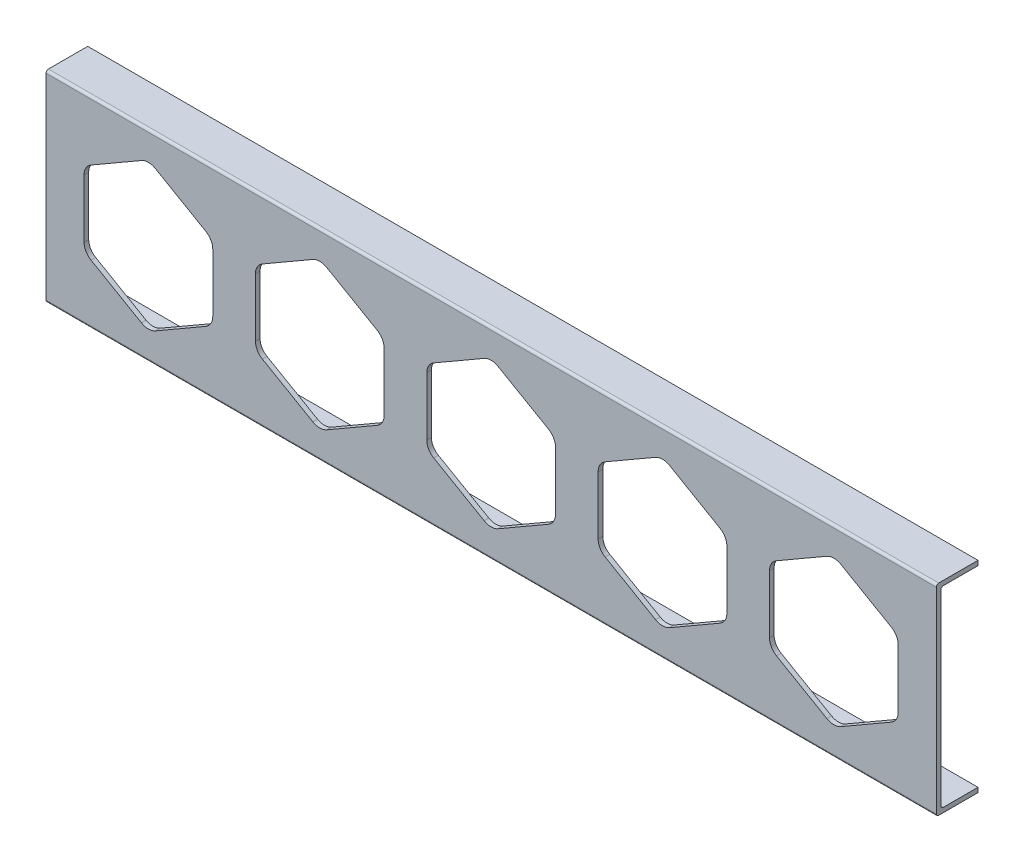
from build123d import *

# Parameters (mm, degrees)
BOSS_EXTRUDE1_DEPTH = 304.8
CUT_EXTRUDE1_REACH  = 314.468


with BuildPart() as part:
    # Sketch1 → Boss-Extrude1 (new body)
    with BuildSketch(Plane(origin=(0, 0, 0), x_dir=(0, 0, -1), z_dir=(1, 0, 0))):
        with BuildLine():
            Line((-0.762, 67.29984), (12.7, 67.29984))
            Line((12.7, 67.29984), (12.7, 65.71234))
            Line((12.7, 65.71234), (0.8255, 65.71234))
            ThreePointArc((0.8255, 65.71234), (0.241783352, 65.470556648), (0, 64.88684))
            Line((0, 64.88684), (0, 0.8255))
            ThreePointArc((0, 0.8255), (0.241783352, 0.241783352), (0.8255, 0))
            Line((0.8255, 0), (12.7, 0))
            Line((12.7, 0), (12.7, -1.5875))
            Line((12.7, -1.5875), (-0.762, -1.5875))
            ThreePointArc((-0.762, -1.5875), (-1.345716648, -1.345716648), (-1.5875, -0.762))
            Line((-1.5875, -0.762), (-1.5875, 66.47434))
            ThreePointArc((-1.5875, 66.47434), (-1.345716648, 67.058056648), (-0.762, 67.29984))
        make_face()
    extrude(amount=BOSS_EXTRUDE1_DEPTH)

    # Sketch2 → Cut-Extrude1 (cut, up to next)
    with BuildSketch(Plane.XY.offset(1.5875), mode=Mode.PRIVATE) as cut_extrude1_sk1:
        with BuildLine():
            Line((32.681340962, 56.921546337), (15.411988703, 46.951081161))
            ThreePointArc((15.411988703, 46.951081161), (13.668792717, 45.207885176), (13.030738703, 42.826635176))
            Line((13.030738703, 42.826635176), (13.030738703, 22.885704824))
            ThreePointArc((13.030738703, 22.885704824), (13.668792717, 20.504454824), (15.411988703, 18.761258839))
            Line((15.411988703, 18.761258839), (32.681340962, 8.790793663))
            ThreePointArc((32.681340962, 8.790793663), (35.062590962, 8.152739649), (37.443840962, 8.790793663))
            Line((37.443840962, 8.790793663), (54.713193222, 18.761258839))
            ThreePointArc((54.713193222, 18.761258839), (56.456389207, 20.504454824), (57.094443222, 22.885704824))
            Line((57.094443222, 22.885704824), (57.094443222, 42.826635176))
            ThreePointArc((57.094443222, 42.826635176), (56.456389207, 45.207885176), (54.713193222, 46.951081161))
            Line((54.713193222, 46.951081161), (37.443840962, 56.921546337))
            ThreePointArc((37.443840962, 56.921546337), (35.062590962, 57.559600351), (32.681340962, 56.921546337))
        make_face()
    cut_extrude1_tool1 = extrude(cut_extrude1_sk1.sketch, amount=-CUT_EXTRUDE1_REACH, mode=Mode.PRIVATE) & part.part
    # Sketch2 → Cut-Extrude1 (cut, up to next)
    with BuildSketch(Plane.XY.offset(1.5875), mode=Mode.PRIVATE) as cut_extrude1_sk2:
        with BuildLine():
            Line((91.350045481, 56.921546337), (74.080693222, 46.951081161))
            ThreePointArc((74.080693222, 46.951081161), (72.337497236, 45.207885176), (71.699443222, 42.826635176))
            Line((71.699443222, 42.826635176), (71.699443222, 22.885704824))
            ThreePointArc((71.699443222, 22.885704824), (72.337497236, 20.504454824), (74.080693222, 18.761258839))
            Line((74.080693222, 18.761258839), (91.350045481, 8.790793663))
            ThreePointArc((91.350045481, 8.790793663), (93.731295481, 8.152739649), (96.112545481, 8.790793663))
            Line((96.112545481, 8.790793663), (113.381897741, 18.761258839))
            ThreePointArc((113.381897741, 18.761258839), (115.125093726, 20.504454824), (115.763147741, 22.885704824))
            Line((115.763147741, 22.885704824), (115.763147741, 42.826635176))
            ThreePointArc((115.763147741, 42.826635176), (115.125093726, 45.207885176), (113.381897741, 46.951081161))
            Line((113.381897741, 46.951081161), (96.112545481, 56.921546337))
            ThreePointArc((96.112545481, 56.921546337), (93.731295481, 57.559600351), (91.350045481, 56.921546337))
        make_face()
    cut_extrude1_tool2 = extrude(cut_extrude1_sk2.sketch, amount=-CUT_EXTRUDE1_REACH, mode=Mode.PRIVATE) & part.part
    # Sketch2 → Cut-Extrude1 (cut, up to next)
    with BuildSketch(Plane.XY.offset(1.5875), mode=Mode.PRIVATE) as cut_extrude1_sk3:
        with BuildLine():
            Line((150.01875, 56.921546337), (132.749397741, 46.951081161))
            ThreePointArc((132.749397741, 46.951081161), (131.006201755, 45.207885176), (130.368147741, 42.826635176))
            Line((130.368147741, 42.826635176), (130.368147741, 22.885704824))
            ThreePointArc((130.368147741, 22.885704824), (131.006201755, 20.504454824), (132.749397741, 18.761258839))
            Line((132.749397741, 18.761258839), (150.01875, 8.790793663))
            ThreePointArc((150.01875, 8.790793663), (152.4, 8.152739649), (154.78125, 8.790793663))
            Line((154.78125, 8.790793663), (172.050602259, 18.761258839))
            ThreePointArc((172.050602259, 18.761258839), (173.793798245, 20.504454824), (174.431852259, 22.885704824))
            Line((174.431852259, 22.885704824), (174.431852259, 42.826635176))
            ThreePointArc((174.431852259, 42.826635176), (173.793798245, 45.207885176), (172.050602259, 46.951081161))
            Line((172.050602259, 46.951081161), (154.78125, 56.921546337))
            ThreePointArc((154.78125, 56.921546337), (152.4, 57.559600351), (150.01875, 56.921546337))
        make_face()
    cut_extrude1_tool3 = extrude(cut_extrude1_sk3.sketch, amount=-CUT_EXTRUDE1_REACH, mode=Mode.PRIVATE) & part.part
    # Sketch2 → Cut-Extrude1 (cut, up to next)
    with BuildSketch(Plane.XY.offset(1.5875), mode=Mode.PRIVATE) as cut_extrude1_sk4:
        with BuildLine():
            Line((208.687454519, 56.921546337), (191.418102259, 46.951081161))
            ThreePointArc((191.418102259, 46.951081161), (189.674906274, 45.207885176), (189.036852259, 42.826635176))
            Line((189.036852259, 42.826635176), (189.036852259, 22.885704824))
            ThreePointArc((189.036852259, 22.885704824), (189.674906274, 20.504454824), (191.418102259, 18.761258839))
            Line((191.418102259, 18.761258839), (208.687454519, 8.790793663))
            ThreePointArc((208.687454519, 8.790793663), (211.068704519, 8.152739649), (213.449954519, 8.790793663))
            Line((213.449954519, 8.790793663), (230.719306778, 18.761258839))
            ThreePointArc((230.719306778, 18.761258839), (232.462502764, 20.504454824), (233.100556778, 22.885704824))
            Line((233.100556778, 22.885704824), (233.100556778, 42.826635176))
            ThreePointArc((233.100556778, 42.826635176), (232.462502764, 45.207885176), (230.719306778, 46.951081161))
            Line((230.719306778, 46.951081161), (213.449954519, 56.921546337))
            ThreePointArc((213.449954519, 56.921546337), (211.068704519, 57.559600351), (208.687454519, 56.921546337))
        make_face()
    cut_extrude1_tool4 = extrude(cut_extrude1_sk4.sketch, amount=-CUT_EXTRUDE1_REACH, mode=Mode.PRIVATE) & part.part
    # Sketch2 → Cut-Extrude1 (cut, up to next)
    with BuildSketch(Plane.XY.offset(1.5875), mode=Mode.PRIVATE) as cut_extrude1_sk5:
        with BuildLine():
            Line((267.356159038, 56.921546337), (250.086806778, 46.951081161))
            ThreePointArc((250.086806778, 46.951081161), (248.343610793, 45.207885176), (247.705556778, 42.826635176))
            Line((247.705556778, 42.826635176), (247.705556778, 22.885704824))
            ThreePointArc((247.705556778, 22.885704824), (248.343610793, 20.504454824), (250.086806778, 18.761258839))
            Line((250.086806778, 18.761258839), (267.356159038, 8.790793663))
            ThreePointArc((267.356159038, 8.790793663), (269.737409038, 8.152739649), (272.118659038, 8.790793663))
            Line((272.118659038, 8.790793663), (289.388011297, 18.761258839))
            ThreePointArc((289.388011297, 18.761258839), (291.131207283, 20.504454824), (291.769261297, 22.885704824))
            Line((291.769261297, 22.885704824), (291.769261297, 42.826635176))
            ThreePointArc((291.769261297, 42.826635176), (291.131207283, 45.207885176), (289.388011297, 46.951081161))
            Line((289.388011297, 46.951081161), (272.118659038, 56.921546337))
            ThreePointArc((272.118659038, 56.921546337), (269.737409038, 57.559600351), (267.356159038, 56.921546337))
        make_face()
    cut_extrude1_tool5 = extrude(cut_extrude1_sk5.sketch, amount=-CUT_EXTRUDE1_REACH, mode=Mode.PRIVATE) & part.part
    add(cut_extrude1_tool1.solids().sort_by_distance((35.062591, 32.85617, 1.5875))[0], mode=Mode.SUBTRACT)
    add(cut_extrude1_tool2.solids().sort_by_distance((93.731295, 32.85617, 1.5875))[0], mode=Mode.SUBTRACT)
    add(cut_extrude1_tool3.solids().sort_by_distance((152.4, 32.85617, 1.5875))[0], mode=Mode.SUBTRACT)
    add(cut_extrude1_tool4.solids().sort_by_distance((211.068705, 32.85617, 1.5875))[0], mode=Mode.SUBTRACT)
    add(cut_extrude1_tool5.solids().sort_by_distance((269.737409, 32.85617, 1.5875))[0], mode=Mode.SUBTRACT)


solid = part.part
